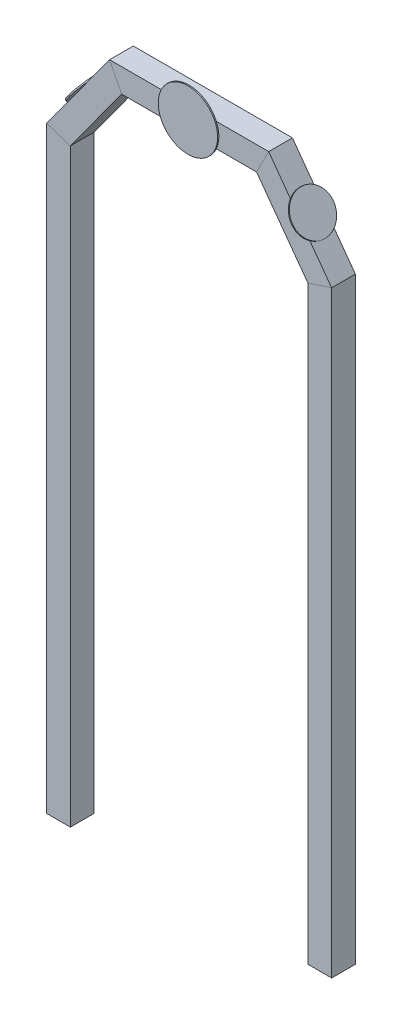
from build123d import *

# Parameters (mm, degrees)
SKETCH2_W           = 60
SKETCH2_H           = 60
SKETCH2_W_2         = 50
SKETCH2_H_2         = 50
SKETCH3_R           = 51.5
BOSS_EXTRUDE1_DEPTH = 3
SKETCH4_R           = 75
BOSS_EXTRUDE2_DEPTH = 3


with BuildPart() as part:
    # Sweep1: sweep along a path in Sketch1
    with BuildLine(Plane.XY) as sweep1_path:
        Line((330, 0), (330, 1500))
        Line((330, 1500), (185.671137026, 1698.283381924))
        Line((185.671137026, 1698.283381924), (0, 1698.283381924))
    # Sketch2 → Sweep1 (sweep)
    with BuildSketch(Plane(origin=(0, 0, 0), x_dir=(1, 0, 0), z_dir=(0, 1, 0))):
        with Locations((330, 0)):
            Rectangle(SKETCH2_W, SKETCH2_H)
        with Locations((330, 0)):
            Rectangle(SKETCH2_W_2, SKETCH2_H_2, mode=Mode.SUBTRACT)
    sweep1 = sweep(path=sweep1_path.line, transition=Transition.RIGHT)

    # Sketch3 → Boss-Extrude1 (add)
    with BuildSketch(Plane(origin=(953.666041456, 694.165764596, 0), x_dir=(0, 0, -1), z_dir=(0.8084979038438049, 0.588499056481974, 0))):
        with Locations((0, 1143.920147163)):
            Circle(SKETCH3_R)
    boss_extrude1 = extrude(amount=BOSS_EXTRUDE1_DEPTH)

    # Mirror1: Sweep1, Boss-Extrude1 across plane
    add(sweep1.mirror(Plane(origin=(0, 0, 0), x_dir=(0, 0, 1), z_dir=(1, 0, 0))))
    add(boss_extrude1.mirror(Plane(origin=(0, 0, 0), x_dir=(0, 0, 1), z_dir=(1, 0, 0))))

    # Sketch4 → Boss-Extrude2 (add)
    with BuildSketch(Plane.XY.offset(30)):
        with Locations((0, 1698.283381924)):
            Circle(SKETCH4_R)
    extrude(amount=BOSS_EXTRUDE2_DEPTH)


solid = part.part
